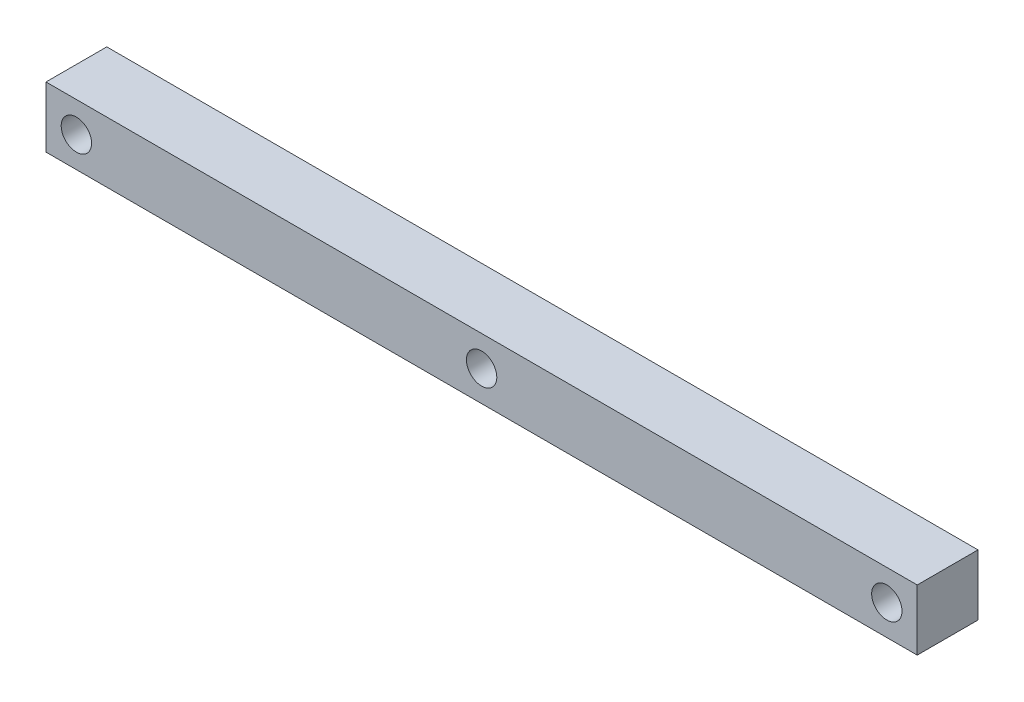
from build123d import *

# Parameters (mm, degrees)
SKETCH1_W           = 430
SKETCH1_H           = 30
SKETCH1_R           = 7.5
BOSS_EXTRUDE1_DEPTH = 15


with BuildPart() as part:
    # Sketch1 → Boss-Extrude1 (new, symmetric)
    with BuildSketch(Plane.XY):
        Rectangle(SKETCH1_W, SKETCH1_H)
        with Locations((-200, 0)):
            Circle(SKETCH1_R, mode=Mode.SUBTRACT)
        with Locations((200, 0)):
            Circle(SKETCH1_R, mode=Mode.SUBTRACT)
        Circle(SKETCH1_R, mode=Mode.SUBTRACT)
    extrude(amount=BOSS_EXTRUDE1_DEPTH, both=True)


solid = part.part
